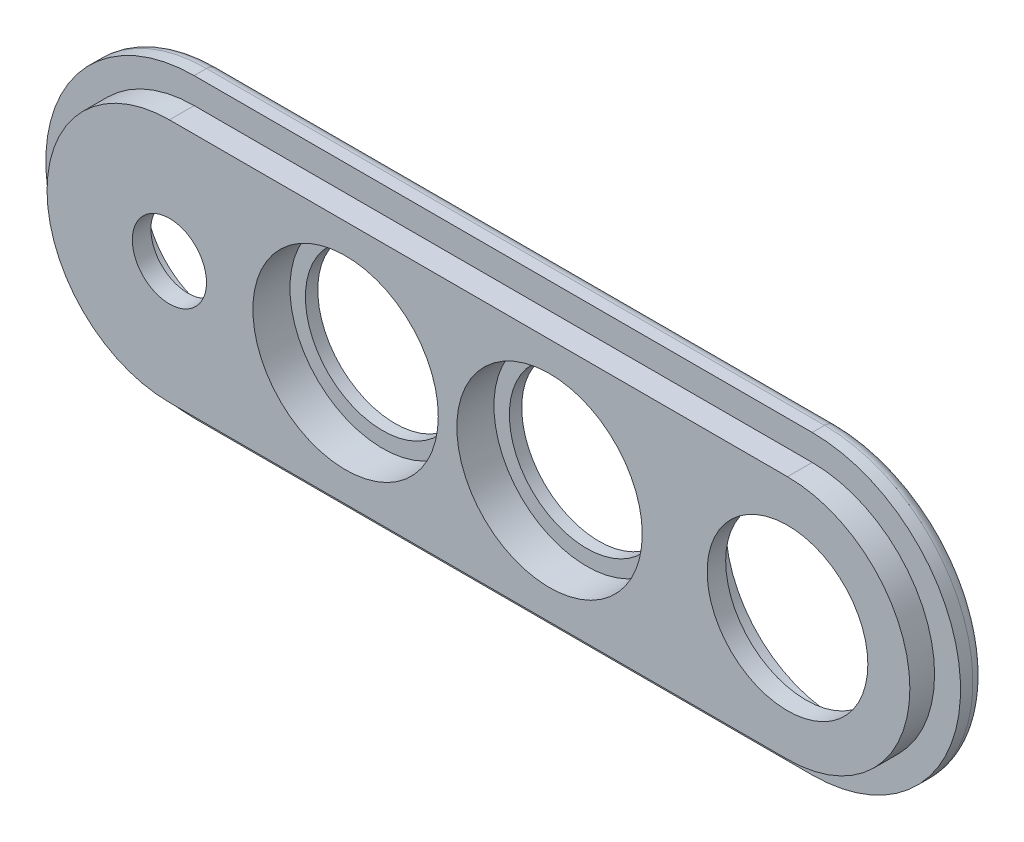
from build123d import *

# Parameters (mm, degrees)
EXTRUDE_1_DEPTH     = 4
CUT_EXTRUDE_1_DEPTH = 2
SKETCH_3_R          = 3
SKETCH_3_R_2        = 6.5
SKETCH_3_R_3        = 6.25
CUT_EXTRUDE_2_DEPTH = 67.603303221
SKETCH_4_R          = 6
SKETCH_4_R_2        = 9
CUT_EXTRUDE_3_DEPTH = 2.5
FILLET_1_R          = 1
SKETCH_7_R          = 7.5
CUT_EXTRUDE_6_DEPTH = 3


with BuildPart() as part:
    # Эскиз1 → Бобышка-Вытянуть1 (new body)
    with BuildSketch(Plane.XY):
        with BuildLine():
            Line((0, 0), (50, 0))
            ThreePointArc((50, 0), (62, -12), (50, -24))
            Line((50, -24), (0, -24))
            ThreePointArc((0, -24), (-12, -12), (0, 0))
        make_face()
    extrude(amount=EXTRUDE_1_DEPTH)

    # Эскиз2 → Вырез-Вытянуть1 (cut)
    with BuildSketch(Plane.XY.offset(4)):
        with BuildLine():
            Line((0, 0.012347922), (50, 0.012347922))
            ThreePointArc((50, 0.012347922), (62.012347922, -12), (50, -24.012347922))
            Line((50, -24.012347922), (0, -24.012347922))
            ThreePointArc((0, -24.012347922), (-12.012347922, -12), (0, 0.012347922))
        make_face()
        with BuildLine():
            Line((0, -2.1), (50, -2.1))
            ThreePointArc((50, -2.1), (59.9, -12), (50, -21.9))
            Line((50, -21.9), (0, -21.9))
            ThreePointArc((0, -21.9), (-9.9, -12), (0, -2.1))
        make_face(mode=Mode.SUBTRACT)
    extrude(amount=-CUT_EXTRUDE_1_DEPTH, mode=Mode.SUBTRACT)

    # Эскиз3 → Вырез-Вытянуть2 (cut, through all)
    with BuildSketch(Plane.XY.offset(4)):
        with Locations((0, -12)):
            Circle(SKETCH_3_R)
        with Locations((50, -12)):
            Circle(SKETCH_3_R_2)
        with Locations((14.25, -12)):
            Circle(SKETCH_3_R_3)
        with Locations((30.75, -12)):
            Circle(SKETCH_3_R_3)
    extrude(amount=-CUT_EXTRUDE_2_DEPTH, mode=Mode.SUBTRACT)

    # Эскиз4 → Вырез-Вытянуть3 (cut)
    with BuildSketch(Plane(origin=(0, 0, 0), x_dir=(-1, 0, 0), z_dir=(0, 0, -1))):
        with Locations((0, -12)):
            Circle(SKETCH_4_R)
        with Locations((-50, -12)):
            Circle(SKETCH_4_R_2)
    extrude(amount=-CUT_EXTRUDE_3_DEPTH, mode=Mode.SUBTRACT)

    # Скругление1
    fillet_1_edges = [part.edges().sort_by_distance(p)[0] for p in [
        (62, -12, 0),
        (25, -24, 0),
        (-12, -12, 0),
        (25, 0, 0),
    ]]
    fillet(fillet_1_edges, radius=FILLET_1_R)

    # Эскиз7 → Вырез-Вытянуть6 (cut)
    with BuildSketch(Plane.XY.offset(4)):
        with Locations((30.75, -12)):
            Circle(SKETCH_7_R)
        with Locations((14.25, -12)):
            Circle(SKETCH_7_R)
    extrude(amount=-CUT_EXTRUDE_6_DEPTH, mode=Mode.SUBTRACT)


solid = part.part
